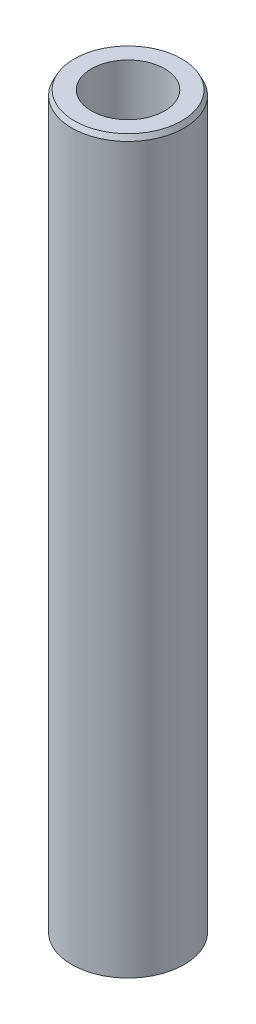
from build123d import *
from OCP.BRepFilletAPI import BRepFilletAPI_MakeChamfer

# Parameters (mm, degrees)
SKETCH1_R           = 32.5
BOSS_EXTRUDE1_DEPTH = 422.836836997
SKETCH2_R           = 21.153580954
CUT_EXTRUDE1_DEPTH  = 426.327509952
CHAMFER1_SIZE       = 2.864994114
CHAMFER1_SIZE2      = 1.459911173


with BuildPart() as part:
    # Sketch1 → Boss-Extrude1 (new body)
    with BuildSketch(Plane(origin=(0, 0, 0), x_dir=(1, 0, 0), z_dir=(0, 1, 0))):
        Circle(SKETCH1_R)
    extrude(amount=BOSS_EXTRUDE1_DEPTH)

    # Sketch2 → Cut-Extrude1 (cut, through all)
    with BuildSketch(Plane(origin=(0, 0, 0), x_dir=(1, 0, 0), z_dir=(0, 1, 0))):
        Circle(SKETCH2_R)
    extrude(amount=CUT_EXTRUDE1_DEPTH, mode=Mode.SUBTRACT)

    # Chamfer1: one chamfer whose edges measure the first distance from different faces: ONE call of the kernel's chamfer builder (chamfer() names one face for all edges)
    chamfer1_edges_1 = [part.edges().sort_by_distance(p)[0] for p in [
        (-32.5, 422.836836997, 0),
    ]]
    chamfer1_side_1 = [part.faces().sort_by_distance(p)[0] for p in [
        (-32.5, 211.418418498, 0),
    ]]
    chamfer1_edges_2 = [part.edges().sort_by_distance(p)[0] for p in [
        (-32.5, 0, 0),
    ]]
    chamfer1_side_2 = [part.faces().sort_by_distance(p)[0] for p in [
        (-31.580761184, 0, 0),
    ]]
    chamfer1 = BRepFilletAPI_MakeChamfer(part.part.solid().wrapped)
    for e in chamfer1_edges_1:
        chamfer1.Add(CHAMFER1_SIZE, CHAMFER1_SIZE2, e.wrapped, chamfer1_side_1[0].wrapped)  # the first distance lies on this face
    for e in chamfer1_edges_2:
        chamfer1.Add(CHAMFER1_SIZE, CHAMFER1_SIZE2, e.wrapped, chamfer1_side_2[0].wrapped)  # the first distance lies on this face
    add(Compound.cast(chamfer1.Shape()), mode=Mode.REPLACE)


solid = part.part
